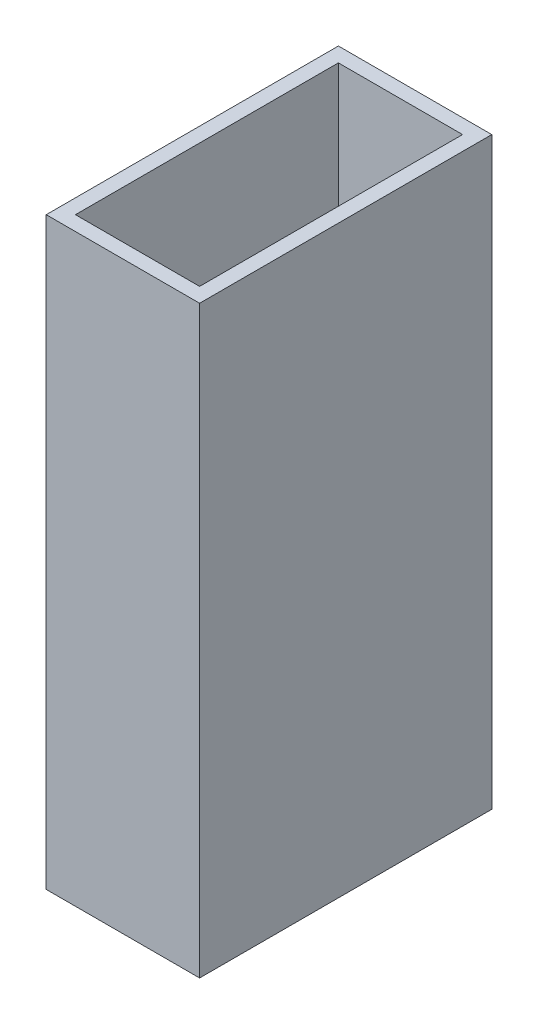
from build123d import *

# Parameters (mm, degrees)
SKETCH1_W           = 52.5
SKETCH1_H           = 100
BOSS_EXTRUDE1_DEPTH = 200
SHELL1_T            = -5


with BuildPart() as part:
    # Sketch1 → Boss-Extrude1 (new body)
    with BuildSketch(Plane(origin=(0, 0, 0), x_dir=(1, 0, 0), z_dir=(0, 1, 0))):
        Rectangle(SKETCH1_W, SKETCH1_H)
    extrude(amount=BOSS_EXTRUDE1_DEPTH)

    # Shell1
    shell1_openings = [part.faces().sort_by_distance(p)[0] for p in [
        (0, 200, 0),
    ]]
    offset(amount=SHELL1_T, openings=shell1_openings, kind=Kind.INTERSECTION)


solid = part.part
